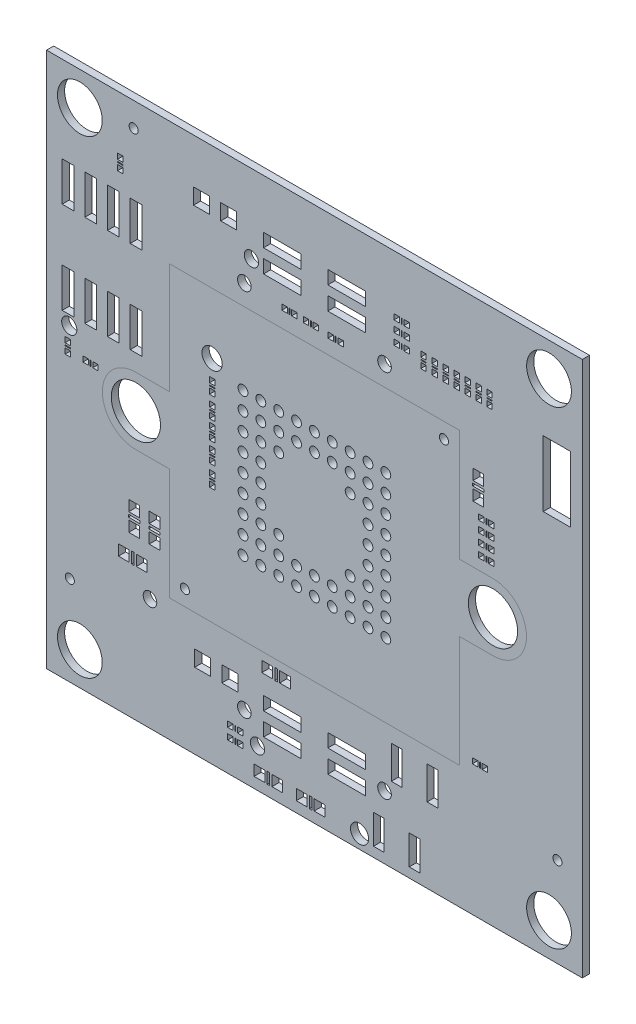
from build123d import *

# Parameters (mm, degrees)
SKETCH2_W           = 750
SKETCH2_H           = 750
BOSS_EXTRUDE1_DEPTH = 10
MODEL_R             = 9.499944
MODEL_R_2           = 6.3500127
MODEL_R_3           = 34.47516895
MODEL_R_4           = 9.537394075
MODEL_R_5           = 6.873888748
MODEL_R_6           = 31.3500127
MODEL_R_7           = 12.700175402
MODEL_R_8           = 9.999820003
MODEL_R_9           = 9.999832503
MODEL_R_10          = 10.632746266
MODEL_R_11          = 14.1999034
MODEL_W             = 14.997479995
MODEL_H             = 46.250317501
MODEL_H_2           = 41.250332501
MODEL_W_2           = 52.500005
MODEL_H_3           = 18.750312501
MODEL_W_3           = 7.62001524
MODEL_H_4           = 7.62001524
MODEL_W_4           = 1.27000254
MODEL_H_5           = 7.504465009
MODEL_W_5           = 7.504465009
MODEL_H_6           = 1.27000254
MODEL_W_6           = 7.504440009
MODEL_H_7           = 14.997454995
MODEL_H_8           = 14.997454994
MODEL_W_7           = 15.999481999
MODEL_H_9           = 3.50520701
MODEL_W_8           = 14.997454995
MODEL_H_10          = 14.997479995
MODEL_W_9           = 3.50520701
MODEL_H_11          = 15.999481999
MODEL_W_10          = 22.22504445
MODEL_H_12          = 22.22504445
MODEL_H_13          = 22.225044451
MODEL_W_11          = 3.505207011
MODEL_W_12          = 16.250332501
MODEL_H_14          = 55.00001
MODEL_W_13          = 16.2503325
MODEL_H_15          = 54.999985
MODEL_W_14          = 38.1000762
MODEL_H_16          = 91.998983998
CUT_EXTRUDE1_DEPTH  = 377


with BuildPart() as part:
    # Sketch2 → Boss-Extrude1 (new body)
    with BuildSketch(Plane.XY.offset(100)):
        with Locations((375, 375)):
            Rectangle(SKETCH2_W, SKETCH2_H)
    extrude(amount=BOSS_EXTRUDE1_DEPTH)

    # Model → Cut-Extrude1 (cut)
    with BuildSketch(Plane.XY):
        with Locations((144.780289561, 156.845313691)):
            Circle(MODEL_R)
        with Locations((121.913893828, 716.167132334)):
            Circle(MODEL_R_2)
        with Locations((715.227330455, 125.488950978)):
            Circle(MODEL_R_2)
        with Locations((32.556515113, 125.488950978)):
            Circle(MODEL_R_2)
        with Locations((193.675387351, 193.675387351)):
            Circle(MODEL_R_2)
        with Locations((556.324612649, 556.324612649)):
            Circle(MODEL_R_2)
        with Locations((124.999374999, 375)):
            Circle(MODEL_R_3)
        with Locations((625.000625001, 375)):
            Circle(MODEL_R_3)
        with Locations((473.125471251, 606.026162052)):
            Circle(MODEL_R_4)
        with Locations((276.874528749, 606.026162052)):
            Circle(MODEL_R_4)
        with Locations((473.125471251, 88.500127)):
            Circle(MODEL_R_4)
        with Locations((276.874528749, 88.500127)):
            Circle(MODEL_R_4)
        with Locations((275, 475)):
            Circle(MODEL_R_5)
        with Locations((300, 475)):
            Circle(MODEL_R_5)
        with Locations((325, 475)):
            Circle(MODEL_R_5)
        with Locations((350, 475)):
            Circle(MODEL_R_5)
        with Locations((375, 475)):
            Circle(MODEL_R_5)
        with Locations((400, 475)):
            Circle(MODEL_R_5)
        with Locations((425, 475)):
            Circle(MODEL_R_5)
        with Locations((450, 475)):
            Circle(MODEL_R_5)
        with Locations((475, 475)):
            Circle(MODEL_R_5)
        with Locations((275, 450)):
            Circle(MODEL_R_5)
        with Locations((300, 450)):
            Circle(MODEL_R_5)
        with Locations((325, 450)):
            Circle(MODEL_R_5)
        with Locations((350, 450)):
            Circle(MODEL_R_5)
        with Locations((375, 450)):
            Circle(MODEL_R_5)
        with Locations((400, 450)):
            Circle(MODEL_R_5)
        with Locations((425, 450)):
            Circle(MODEL_R_5)
        with Locations((450, 450)):
            Circle(MODEL_R_5)
        with Locations((475, 450)):
            Circle(MODEL_R_5)
        with Locations((275, 425)):
            Circle(MODEL_R_5)
        with Locations((300, 425)):
            Circle(MODEL_R_5)
        with Locations((325, 425)):
            Circle(MODEL_R_5)
        with Locations((425, 425)):
            Circle(MODEL_R_5)
        with Locations((450, 425)):
            Circle(MODEL_R_5)
        with Locations((475, 425)):
            Circle(MODEL_R_5)
        with Locations((275, 400)):
            Circle(MODEL_R_5)
        with Locations((300, 400)):
            Circle(MODEL_R_5)
        with Locations((450, 400)):
            Circle(MODEL_R_5)
        with Locations((475, 400)):
            Circle(MODEL_R_5)
        with Locations((275, 375)):
            Circle(MODEL_R_5)
        with Locations((300, 375)):
            Circle(MODEL_R_5)
        with Locations((450, 375)):
            Circle(MODEL_R_5)
        with Locations((475, 375)):
            Circle(MODEL_R_5)
        with Locations((275, 350)):
            Circle(MODEL_R_5)
        with Locations((300, 350)):
            Circle(MODEL_R_5)
        with Locations((450, 350)):
            Circle(MODEL_R_5)
        with Locations((475, 350)):
            Circle(MODEL_R_5)
        with Locations((275, 325)):
            Circle(MODEL_R_5)
        with Locations((300, 325)):
            Circle(MODEL_R_5)
        with Locations((325, 325)):
            Circle(MODEL_R_5)
        with Locations((425, 325)):
            Circle(MODEL_R_5)
        with Locations((450, 325)):
            Circle(MODEL_R_5)
        with Locations((475, 325)):
            Circle(MODEL_R_5)
        with Locations((275, 300)):
            Circle(MODEL_R_5)
        with Locations((300, 300)):
            Circle(MODEL_R_5)
        with Locations((325, 300)):
            Circle(MODEL_R_5)
        with Locations((350, 300)):
            Circle(MODEL_R_5)
        with Locations((375, 300)):
            Circle(MODEL_R_5)
        with Locations((400, 300)):
            Circle(MODEL_R_5)
        with Locations((425, 300)):
            Circle(MODEL_R_5)
        with Locations((450, 300)):
            Circle(MODEL_R_5)
        with Locations((475, 300)):
            Circle(MODEL_R_5)
        with Locations((275, 275)):
            Circle(MODEL_R_5)
        with Locations((300, 275)):
            Circle(MODEL_R_5)
        with Locations((325, 275)):
            Circle(MODEL_R_5)
        with Locations((350, 275)):
            Circle(MODEL_R_5)
        with Locations((375, 275)):
            Circle(MODEL_R_5)
        with Locations((400, 275)):
            Circle(MODEL_R_5)
        with Locations((425, 275)):
            Circle(MODEL_R_5)
        with Locations((450, 275)):
            Circle(MODEL_R_5)
        with Locations((475, 275)):
            Circle(MODEL_R_5)
        with Locations((703.40995682, 46.59004318)):
            Circle(MODEL_R_6)
        with Locations((46.59004318, 46.59004318)):
            Circle(MODEL_R_6)
        with Locations((703.40995682, 703.40995682)):
            Circle(MODEL_R_6)
        with Locations((46.59004318, 703.40995682)):
            Circle(MODEL_R_6)
        with Locations((438.151351303, 19.0502131)):
            Circle(MODEL_R_7)
        with Locations((295.275765552, 53.975357951)):
            Circle(MODEL_R_8)
        with Locations((286.750236, 640.362843226)):
            Circle(MODEL_R_9)
        with Locations((31.750413501, 431.800938602)):
            Circle(MODEL_R_10)
        with Locations((231.775463551, 492.125984252)):
            Circle(MODEL_R_11)
        with Locations((490.186055373, 127.920693342)):
            Rectangle(MODEL_W, MODEL_H)
        with Locations((540.186055373, 127.920693342)):
            Rectangle(MODEL_W, MODEL_H)
        with Locations((465.186055373, 34.170368341)):
            Rectangle(MODEL_W, MODEL_H_2)
        with Locations((515.186055373, 34.170368341)):
            Rectangle(MODEL_W, MODEL_H_2)
        with Locations((330.000635001, 78.387094275)):
            Rectangle(MODEL_W_2, MODEL_H_3)
        with Locations((330.000635001, 110.137157775)):
            Rectangle(MODEL_W_2, MODEL_H_3)
        with Locations((420.000640001, 78.387094275)):
            Rectangle(MODEL_W_2, MODEL_H_3)
        with Locations((420.000640001, 110.137157775)):
            Rectangle(MODEL_W_2, MODEL_H_3)
        with Locations((330.000635001, 639.862842226)):
            Rectangle(MODEL_W_2, MODEL_H_3)
        with Locations((330.000635001, 671.612905726)):
            Rectangle(MODEL_W_2, MODEL_H_3)
        with Locations((420.000640001, 639.862842226)):
            Rectangle(MODEL_W_2, MODEL_H_3)
        with Locations((420.000640001, 671.612905726)):
            Rectangle(MODEL_W_2, MODEL_H_3)
        with Locations((599.876799754, 186.487172974)):
            Rectangle(MODEL_W_3, MODEL_H_4)
        with Locations((613.712227424, 186.487172974)):
            Rectangle(MODEL_W_3, MODEL_H_4)
        with Locations((606.794513589, 186.487172974)):
            Rectangle(MODEL_W_4, MODEL_H_5)
        with Locations((271.10999222, 59.531369063)):
            Rectangle(MODEL_W_3, MODEL_H_4)
        with Locations((257.274564549, 59.531369063)):
            Rectangle(MODEL_W_3, MODEL_H_4)
        with Locations((264.192278385, 59.531369063)):
            Rectangle(MODEL_W_4, MODEL_H_5)
        with Locations((271.217942436, 44.208788418)):
            Rectangle(MODEL_W_3, MODEL_H_4)
        with Locations((257.382514765, 44.208788418)):
            Rectangle(MODEL_W_3, MODEL_H_4)
        with Locations((264.3002286, 44.208788418)):
            Rectangle(MODEL_W_4, MODEL_H_5)
        with Locations((620.078740157, 643.506487013)):
            Rectangle(MODEL_W_3, MODEL_H_4)
        with Locations((620.078740157, 629.671059342)):
            Rectangle(MODEL_W_3, MODEL_H_4)
        with Locations((620.078740158, 636.588773178)):
            Rectangle(MODEL_W_5, MODEL_H_6)
        with Locations((604.838709677, 629.671059342)):
            Rectangle(MODEL_W_3, MODEL_H_4)
        with Locations((604.838709677, 643.506487013)):
            Rectangle(MODEL_W_3, MODEL_H_4)
        with Locations((604.838709677, 636.588773178)):
            Rectangle(MODEL_W_5, MODEL_H_6)
        with Locations((622.551445103, 471.170942342)):
            Rectangle(MODEL_W_3, MODEL_H_4)
        with Locations((608.716017432, 471.170942342)):
            Rectangle(MODEL_W_3, MODEL_H_4)
        with Locations((615.633731267, 471.170942342)):
            Rectangle(MODEL_W_4, MODEL_H_5)
        with Locations((608.716017432, 455.930911862)):
            Rectangle(MODEL_W_3, MODEL_H_4)
        with Locations((622.551445103, 455.930911862)):
            Rectangle(MODEL_W_3, MODEL_H_4)
        with Locations((615.633731267, 455.930911862)):
            Rectangle(MODEL_W_4, MODEL_H_5)
        with Locations((103.187706375, 671.129042258)):
            Rectangle(MODEL_W_3, MODEL_H_4)
        with Locations((103.187706375, 657.293614587)):
            Rectangle(MODEL_W_3, MODEL_H_4)
        with Locations((103.187706375, 664.211328423)):
            Rectangle(MODEL_W_5, MODEL_H_6)
        with Locations((68.512837026, 401.003302007)):
            Rectangle(MODEL_W_3, MODEL_H_4)
        with Locations((54.677409355, 401.003302007)):
            Rectangle(MODEL_W_3, MODEL_H_4)
        with Locations((61.59512319, 401.003302007)):
            Rectangle(MODEL_W_4, MODEL_H_5)
        with Locations((29.84505969, 398.213096426)):
            Rectangle(MODEL_W_3, MODEL_H_4)
        with Locations((29.84505969, 412.048524097)):
            Rectangle(MODEL_W_3, MODEL_H_4)
        with Locations((29.845059691, 405.130810262)):
            Rectangle(MODEL_W_5, MODEL_H_6)
        with Locations((558.801117602, 643.506487013)):
            Rectangle(MODEL_W_3, MODEL_H_4)
        with Locations((558.801117602, 629.671059342)):
            Rectangle(MODEL_W_3, MODEL_H_4)
        with Locations((558.801117602, 636.588773178)):
            Rectangle(MODEL_W_5, MODEL_H_6)
        with Locations((543.243586487, 629.671059342)):
            Rectangle(MODEL_W_3, MODEL_H_4)
        with Locations((543.243586487, 643.506487013)):
            Rectangle(MODEL_W_3, MODEL_H_4)
        with Locations((543.243586488, 636.588773178)):
            Rectangle(MODEL_W_5, MODEL_H_6)
        with Locations((504.191008382, 639.128778258)):
            Rectangle(MODEL_W_3, MODEL_H_4)
        with Locations((490.355605711, 639.128778258)):
            Rectangle(MODEL_W_3, MODEL_H_4)
        with Locations((497.273294547, 639.128778258)):
            Rectangle(MODEL_W_4, MODEL_H_5)
        with Locations((574.358648717, 643.506487013)):
            Rectangle(MODEL_W_3, MODEL_H_4)
        with Locations((574.358648717, 629.671059342)):
            Rectangle(MODEL_W_3, MODEL_H_4)
        with Locations((574.358648718, 636.588773178)):
            Rectangle(MODEL_W_5, MODEL_H_6)
        with Locations((589.598679197, 629.671059342)):
            Rectangle(MODEL_W_3, MODEL_H_4)
        with Locations((589.598679197, 643.506487013)):
            Rectangle(MODEL_W_3, MODEL_H_4)
        with Locations((589.598679198, 636.588773178)):
            Rectangle(MODEL_W_5, MODEL_H_6)
        with Locations((527.686055372, 629.671059342)):
            Rectangle(MODEL_W_3, MODEL_H_4)
        with Locations((527.686055372, 643.506487013)):
            Rectangle(MODEL_W_3, MODEL_H_4)
        with Locations((527.686055373, 636.588773178)):
            Rectangle(MODEL_W_5, MODEL_H_6)
        with Locations((608.716017432, 440.690881382)):
            Rectangle(MODEL_W_3, MODEL_H_4)
        with Locations((622.551445103, 440.690881382)):
            Rectangle(MODEL_W_3, MODEL_H_4)
        with Locations((615.633731267, 440.690881382)):
            Rectangle(MODEL_W_4, MODEL_H_5)
        with Locations((504.123708247, 669.926339853)):
            Rectangle(MODEL_W_3, MODEL_H_4)
        with Locations((490.288280577, 669.926339853)):
            Rectangle(MODEL_W_3, MODEL_H_4)
        with Locations((497.205994412, 669.926339852)):
            Rectangle(MODEL_W_4, MODEL_H_5)
        with Locations((504.191008382, 654.686309373)):
            Rectangle(MODEL_W_3, MODEL_H_4)
        with Locations((490.355605711, 654.686309373)):
            Rectangle(MODEL_W_3, MODEL_H_4)
        with Locations((497.273294547, 654.686309373)):
            Rectangle(MODEL_W_4, MODEL_H_5)
        with Locations((333.192791386, 603.213106426)):
            Rectangle(MODEL_W_3, MODEL_H_4)
        with Locations((347.028194056, 603.213106426)):
            Rectangle(MODEL_W_3, MODEL_H_4)
        with Locations((340.110480221, 603.213106426)):
            Rectangle(MODEL_W_4, MODEL_H_5)
        with Locations((377.030729061, 603.213106426)):
            Rectangle(MODEL_W_3, MODEL_H_4)
        with Locations((363.195326391, 603.213106426)):
            Rectangle(MODEL_W_3, MODEL_H_4)
        with Locations((370.113040226, 603.213106426)):
            Rectangle(MODEL_W_4, MODEL_H_5)
        with Locations((411.572273145, 601.50495301)):
            Rectangle(MODEL_W_3, MODEL_H_4)
        with Locations((397.736845474, 601.50495301)):
            Rectangle(MODEL_W_3, MODEL_H_4)
        with Locations((404.654559309, 601.50495301)):
            Rectangle(MODEL_W_4, MODEL_H_5)
        with Locations((622.551445103, 486.410972822)):
            Rectangle(MODEL_W_3, MODEL_H_4)
        with Locations((608.716017432, 486.410972822)):
            Rectangle(MODEL_W_3, MODEL_H_4)
        with Locations((615.633731267, 486.410972822)):
            Rectangle(MODEL_W_4, MODEL_H_5)
        with Locations((231.967863936, 409.013218026)):
            Rectangle(MODEL_W_3, MODEL_H_4)
        with Locations((231.967863936, 395.177790356)):
            Rectangle(MODEL_W_3, MODEL_H_4)
        with Locations((231.967876436, 402.095504191)):
            Rectangle(MODEL_W_6, MODEL_H_6)
        with Locations((231.967863936, 381.060462121)):
            Rectangle(MODEL_W_3, MODEL_H_4)
        with Locations((231.967863936, 367.22503445)):
            Rectangle(MODEL_W_3, MODEL_H_4)
        with Locations((231.967876436, 374.142748285)):
            Rectangle(MODEL_W_6, MODEL_H_6)
        with Locations((231.967863936, 421.221117442)):
            Rectangle(MODEL_W_3, MODEL_H_4)
        with Locations((231.967863936, 435.056520113)):
            Rectangle(MODEL_W_3, MODEL_H_4)
        with Locations((231.967876436, 428.138806278)):
            Rectangle(MODEL_W_6, MODEL_H_6)
        with Locations((231.967863936, 337.913375827)):
            Rectangle(MODEL_W_3, MODEL_H_4)
        with Locations((231.967863936, 351.748803498)):
            Rectangle(MODEL_W_3, MODEL_H_4)
        with Locations((231.967876436, 344.831089662)):
            Rectangle(MODEL_W_6, MODEL_H_6)
        with Locations((231.967863936, 464.524379049)):
            Rectangle(MODEL_W_3, MODEL_H_4)
        with Locations((231.967863936, 450.688976378)):
            Rectangle(MODEL_W_3, MODEL_H_4)
        with Locations((231.967876436, 457.606690213)):
            Rectangle(MODEL_W_6, MODEL_H_6)
        with Locations((604.521209043, 534.156080813)):
            Rectangle(MODEL_W, MODEL_H_7)
        with Locations((604.521209043, 509.151005802)):
            Rectangle(MODEL_W, MODEL_H_8)
        with Locations((604.521209043, 521.653543307)):
            Rectangle(MODEL_W_7, MODEL_H_9)
        with Locations((151.130302261, 255.390523282)):
            Rectangle(MODEL_W, MODEL_H_7)
        with Locations((151.130302261, 230.385448271)):
            Rectangle(MODEL_W, MODEL_H_7)
        with Locations((151.130302261, 242.887985776)):
            Rectangle(MODEL_W_7, MODEL_H_9)
        with Locations((308.808105117, 153.352806706)):
            Rectangle(MODEL_W_8, MODEL_H_10)
        with Locations((333.813180127, 153.352806706)):
            Rectangle(MODEL_W_8, MODEL_H_10)
        with Locations((321.310642621, 153.352806706)):
            Rectangle(MODEL_W_9, MODEL_H_11)
        with Locations((254.953009906, 675.958851918)):
            Rectangle(MODEL_W_10, MODEL_H_12)
        with Locations((216.852933706, 675.958851918)):
            Rectangle(MODEL_W_10, MODEL_H_12)
        with Locations((256.540513081, 116.522733046)):
            Rectangle(MODEL_W_10, MODEL_H_13)
        with Locations((218.440436881, 116.522733046)):
            Rectangle(MODEL_W_10, MODEL_H_13)
        with Locations((323.018158537, 22.225044451)):
            Rectangle(MODEL_W_8, MODEL_H_10)
        with Locations((298.013083526, 22.225044451)):
            Rectangle(MODEL_W_8, MODEL_H_10)
        with Locations((310.515621031, 22.225044451)):
            Rectangle(MODEL_W_9, MODEL_H_11)
        with Locations((357.068201637, 22.225044451)):
            Rectangle(MODEL_W_8, MODEL_H_10)
        with Locations((382.073276647, 22.225044451)):
            Rectangle(MODEL_W_8, MODEL_H_10)
        with Locations((369.570739141, 22.225044451)):
            Rectangle(MODEL_W_11, MODEL_H_11)
        with Locations((122.555245111, 230.385448271)):
            Rectangle(MODEL_W, MODEL_H_7)
        with Locations((122.555245111, 255.390523282)):
            Rectangle(MODEL_W, MODEL_H_7)
        with Locations((122.555245111, 242.887985776)):
            Rectangle(MODEL_W_7, MODEL_H_9)
        with Locations((108.147703796, 194.310388621)):
            Rectangle(MODEL_W_8, MODEL_H_10)
        with Locations((133.152778806, 194.310388621)):
            Rectangle(MODEL_W_8, MODEL_H_10)
        with Locations((120.6502413, 194.310388621)):
            Rectangle(MODEL_W_11, MODEL_H_11)
        with Locations((29.968884938, 601.651003302)):
            Rectangle(MODEL_W_12, MODEL_H_14)
        with Locations((61.718948438, 601.651003302)):
            Rectangle(MODEL_W_13, MODEL_H_14)
        with Locations((93.469011938, 601.651003302)):
            Rectangle(MODEL_W_13, MODEL_H_14)
        with Locations((125.219075438, 601.651003302)):
            Rectangle(MODEL_W_13, MODEL_H_14)
        with Locations((125.219075438, 472.895608291)):
            Rectangle(MODEL_W_13, MODEL_H_15)
        with Locations((93.469011938, 472.895608291)):
            Rectangle(MODEL_W_13, MODEL_H_15)
        with Locations((61.718948438, 472.895608291)):
            Rectangle(MODEL_W_13, MODEL_H_15)
        with Locations((29.968884938, 472.895608291)):
            Rectangle(MODEL_W_12, MODEL_H_15)
        with Locations((714.376428753, 584.201168402)):
            Rectangle(MODEL_W_14, MODEL_H_16)
    extrude(amount=CUT_EXTRUDE1_DEPTH, mode=Mode.SUBTRACT)


solid = part.part
